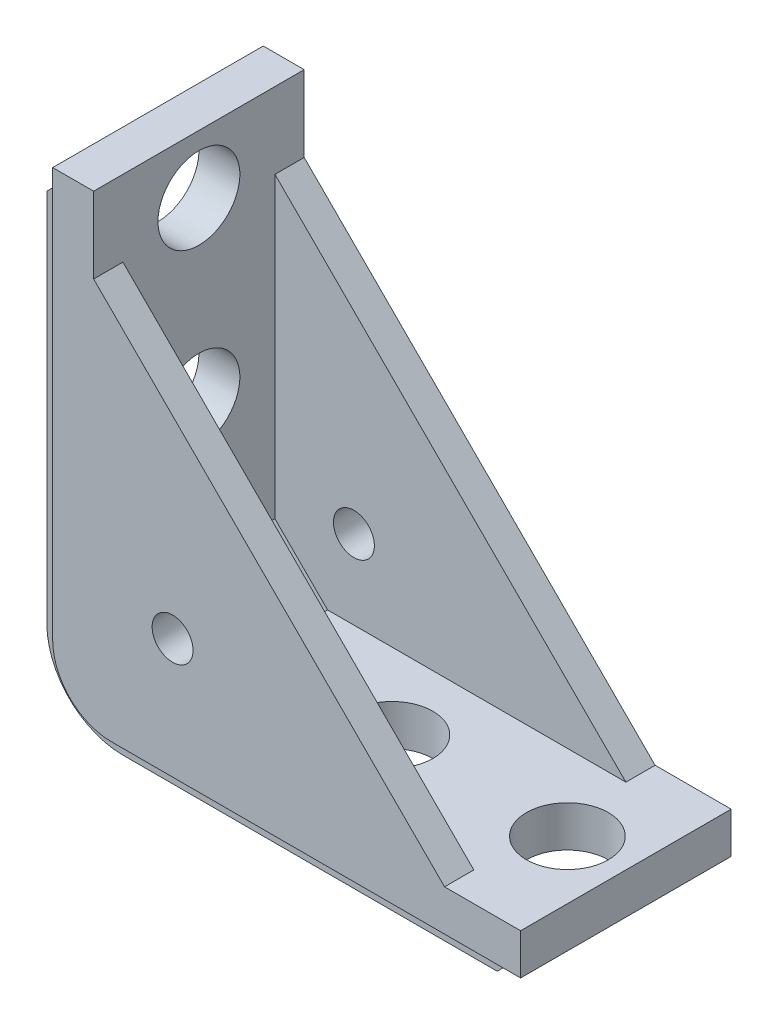
from build123d import *
from OCP.BRepFilletAPI import BRepFilletAPI_MakeFillet

# Parameters (mm, degrees)
SKETCH_1_W           = 41.5
SKETCH_1_H           = 18
EXTRUDE_1_DEPTH      = 41.5
CUT_EXTRUDE_2_DEPTH  = 41.5
CUT_EXTRUDE_3_DEPTH  = 1.5
SKETCH_4_W           = 10
SKETCH_4_H           = 42.806652411
CUT_EXTRUDE_4_DEPTH  = 1.5
SKETCH_5_W           = 46.146220502
SKETCH_5_H           = 19
SKETCH_5_W_2         = 42.146220502
SKETCH_5_H_2         = 16
CUT_EXTRUDE_5_DEPTH  = 1.5
SKETCH_6_W           = 43.828309831
SKETCH_6_H           = 10
CUT_EXTRUDE_7_DEPTH  = 1.5
FILLET_8_R1          = 5
FILLET_8_R2          = 6.5
CHAMFER_1_SIZE       = 1.5
CUT_EXTRUDE_9_DEPTH  = 13
SKETCH_10_R          = 3.5
CUT_EXTRUDE_10_DEPTH = 10
SKETCH_11_R          = 3.5
CUT_EXTRUDE_11_DEPTH = 5
SKETCH_12_R          = 1.75
CUT_EXTRUDE_12_DEPTH = 20


with BuildPart() as part:
    # 草图1 → 拉伸1 (new body)
    with BuildSketch(Plane(origin=(0, 0, 0), x_dir=(1, 0, 0), z_dir=(0, 1, 0))):
        with Locations((20.75, 9)):
            Rectangle(SKETCH_1_W, SKETCH_1_H)
    extrude(amount=EXTRUDE_1_DEPTH)

    # 草图2 → 拉伸2 (cut)
    with BuildSketch(Plane.XY):
        Polygon((5, 41.5), (41.5, 41.5), (41.5, 5), (35, 5), (5, 35), align=None)
    extrude(amount=-CUT_EXTRUDE_2_DEPTH, mode=Mode.SUBTRACT)

    # 草图3 → 拉伸3 (cut)
    with BuildSketch(Plane.ZY):
        Polygon((1.5, 43), (1.5, -2.474095728), (-1, -2.474095728), (-1, 40), (-17, 40), (-17, -2.474095728), (-19.5, -2.474095728), (-19.5, 43), align=None)
    extrude(amount=-CUT_EXTRUDE_3_DEPTH, mode=Mode.SUBTRACT)

    # 草图4 → 拉伸4 (cut)
    with BuildSketch(Plane.ZY):
        with Locations((-9, 20.096673794)):
            Rectangle(SKETCH_4_W, SKETCH_4_H)
    extrude(amount=-CUT_EXTRUDE_4_DEPTH, mode=Mode.SUBTRACT)

    # 草图5 → 拉伸5 (cut)
    with BuildSketch(Plane.XZ):
        with Locations((19.426889749, -9)):
            Rectangle(SKETCH_5_W, SKETCH_5_H)
        with Locations((18.926889749, -9)):
            Rectangle(SKETCH_5_W_2, SKETCH_5_H_2, mode=Mode.SUBTRACT)
    extrude(amount=-CUT_EXTRUDE_5_DEPTH, mode=Mode.SUBTRACT)

    # 草图6 → 拉伸7 (cut)
    with BuildSketch(Plane.XZ):
        with Locations((19.585845085, -9)):
            Rectangle(SKETCH_6_W, SKETCH_6_H)
    extrude(amount=-CUT_EXTRUDE_7_DEPTH, mode=Mode.SUBTRACT)

    # 圆角8: one fillet with a radius per group of edges: ONE call of the kernel's fillet builder (fillet() takes one radius for all edges)
    fillet_8_edges_1 = [part.edges().sort_by_distance(p)[0] for p in [
        (1.5, 1.5, -17.5),
        (1.5, 1.5, -9),
        (1.5, 1.5, -0.5),
    ]]
    fillet_8_edges_2 = [part.edges().sort_by_distance(p)[0] for p in [
        (0, 0, -15.5),
        (0, 0, -2.5),
    ]]
    fillet_8 = BRepFilletAPI_MakeFillet(part.part.solid().wrapped)
    for e in fillet_8_edges_1:
        fillet_8.Add(FILLET_8_R1, e.wrapped)
    for e in fillet_8_edges_2:
        fillet_8.Add(FILLET_8_R2, e.wrapped)
    add(Compound.cast(fillet_8.Shape()), mode=Mode.REPLACE)

    # 倒角1
    chamfer_1_edges = [part.edges().sort_by_distance(p)[0] for p in [
        (0, 40, -2.5),
        (0, 40, -15.5),
        (40, 0, -2.5),
        (40, 0, -15.5),
    ]]
    chamfer(chamfer_1_edges, length=CHAMFER_1_SIZE - 0.0001)  # a hair under: the kernel refuses the full size

    # 草图9 → 拉伸9 (cut)
    with BuildSketch(Plane(origin=(0, 0, -15.5), x_dir=(-1, 0, 0), z_dir=(0, 0, -1))):
        Polygon((-5, 38.898928625), (-5, 9.5), (-9.5, 5), (-37.05605145, 5), (-37.05605145, 38.898928625), align=None)
    extrude(amount=-CUT_EXTRUDE_9_DEPTH, mode=Mode.SUBTRACT)

    # 草图10 → 拉伸10 (cut)
    with BuildSketch(Plane.XZ.offset(-1.5)):
        with Locations(Location((21.5, -9, 0), (0, 0, 270))):
            Circle(SKETCH_10_R)
        with Locations(Location((36.5, -9, 0), (0, 0, 270))):
            Circle(SKETCH_10_R)
    extrude(amount=-CUT_EXTRUDE_10_DEPTH, mode=Mode.SUBTRACT)

    # 草图11 → 拉伸11 (cut)
    with BuildSketch(Plane.ZY.offset(-1.5)):
        with Locations((-9, 21.5)):
            Circle(SKETCH_11_R)
        with Locations((-9, 36.5)):
            Circle(SKETCH_11_R)
    extrude(amount=-CUT_EXTRUDE_11_DEPTH, mode=Mode.SUBTRACT)

    # 草图12 → 拉伸12 (cut)
    with BuildSketch(Plane.XY):
        with Locations((11.75, 11.75)):
            Circle(SKETCH_12_R)
    extrude(amount=-CUT_EXTRUDE_12_DEPTH, mode=Mode.SUBTRACT)


solid = part.part
